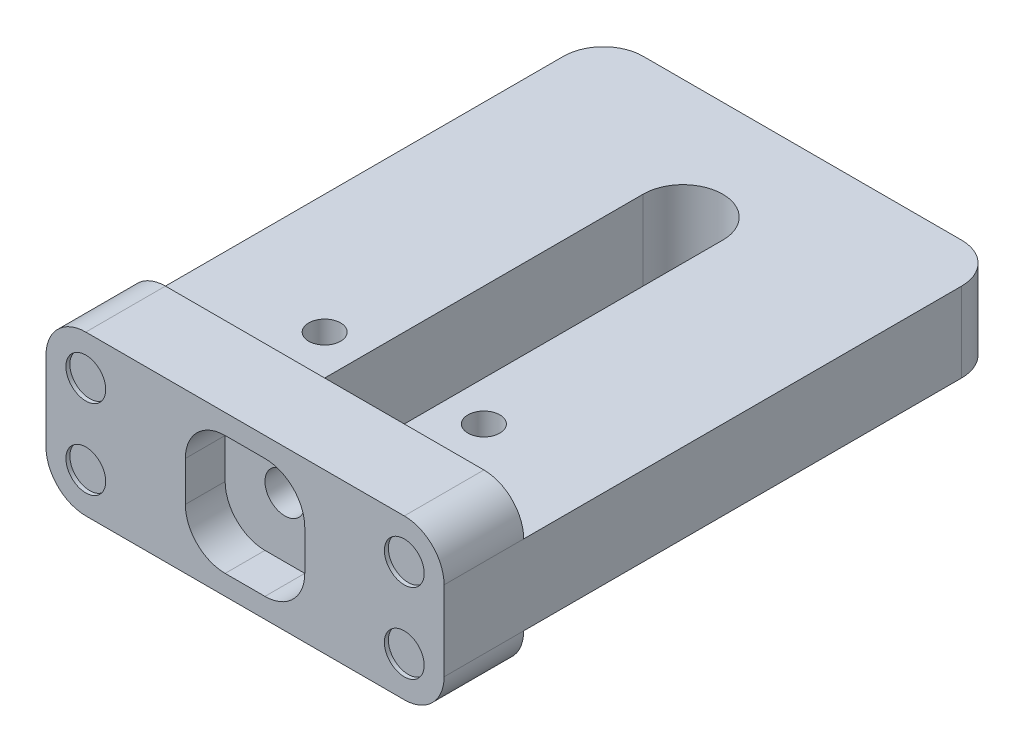
from build123d import *

# Parameters (mm, degrees)
SKETCH_1_W          = 100
SKETCH_1_H          = 120
SKETCH_1_R          = 4
EXTRUDE_1_DEPTH     = 20
SKETCH_4_W          = 100
SKETCH_4_H          = 40
EXTRUDE_2_DEPTH     = 20
SKETCH_5_W          = 30
SKETCH_5_H          = 30
CUT_EXTRUDE_1_DEPTH = 10
SKETCH_7_R          = 5
CUT_EXTRUDE_3_DEPTH = 110
SKETCH_8_R          = 5
CUT_EXTRUDE_4_DEPTH = 1
SKETCH_9_W          = 20
SKETCH_9_H          = 100
CUT_EXTRUDE_6_DEPTH = 99.994949366
FILLET_5_R          = 10
FILLET_2_R          = 10
FILLET_1_R          = 10
FILLET_9_R          = 10


with BuildPart() as part:
    # ｽｹｯﾁ1 → ﾎﾞｽ - 押し出し1 (new body)
    with BuildSketch(Plane(origin=(0, 0, 0), x_dir=(1, 0, 0), z_dir=(0, 1, 0))):
        Rectangle(SKETCH_1_W, SKETCH_1_H)
        with Locations(Location((-20, -40, 0), (0, 0, 270))):
            Circle(SKETCH_1_R, mode=Mode.SUBTRACT)
        with Locations(Location((20, -40, 0), (0, 0, 270))):
            Circle(SKETCH_1_R, mode=Mode.SUBTRACT)
    extrude(amount=EXTRUDE_1_DEPTH)

    # ｽｹｯﾁ4 → ﾎﾞｽ - 押し出し2 (add)
    with BuildSketch(Plane.XY.offset(60)):
        with Locations((0, 10)):
            Rectangle(SKETCH_4_W, SKETCH_4_H)
    extrude(amount=EXTRUDE_2_DEPTH)

    # ｽｹｯﾁ5 → ｶｯﾄ - 押し出し1 (cut)
    with BuildSketch(Plane.XY.offset(80)):
        with Locations((0, 10)):
            Rectangle(SKETCH_5_W, SKETCH_5_H)
    extrude(amount=-CUT_EXTRUDE_1_DEPTH, mode=Mode.SUBTRACT)

    # ｽｹｯﾁ7 → ｶｯﾄ - 押し出し3 (cut)
    with BuildSketch(Plane.XY.offset(70)):
        with Locations((0, 10)):
            Circle(SKETCH_7_R)
    extrude(amount=-CUT_EXTRUDE_3_DEPTH, mode=Mode.SUBTRACT)

    # ｽｹｯﾁ8 → ｶｯﾄ - 押し出し4 (cut)
    with BuildSketch(Plane.XY.offset(80)):
        with Locations((-40, 20)):
            Circle(SKETCH_8_R)
        with Locations(Location((40, 20, 0), (0, 0, 180))):
            Circle(SKETCH_8_R)
        with Locations((40, 0)):
            Circle(SKETCH_8_R)
        with Locations(Location((-40, 0, 0), (0, 0, 180))):
            Circle(SKETCH_8_R)
    extrude(amount=-CUT_EXTRUDE_4_DEPTH, mode=Mode.SUBTRACT)

    # ｽｹｯﾁ9 → ｶｯﾄ - 押し出し6 (cut, through all)
    with BuildSketch(Plane(origin=(0, 20, 0), x_dir=(1, 0, 0), z_dir=(0, 1, 0))):
        with Locations((0, -10)):
            Rectangle(SKETCH_9_W, SKETCH_9_H)
    extrude(amount=-CUT_EXTRUDE_6_DEPTH, mode=Mode.SUBTRACT)

    # ﾌｨﾚｯﾄ5
    fillet_5_edges = [part.edges().sort_by_distance(p)[0] for p in [
        (15, 25, 75),
        (15, -5, 75),
        (-15, -5, 75),
        (-15, 25, 75),
    ]]
    fillet(fillet_5_edges, radius=FILLET_5_R)

    # ﾌｨﾚｯﾄ2
    fillet_2_edges = [part.edges().sort_by_distance(p)[0] for p in [
        (-50, 10, -60),
        (50, 10, -60),
    ]]
    fillet(fillet_2_edges, radius=FILLET_2_R)

    # ﾌｨﾚｯﾄ1
    fillet_1_edges = [part.edges().sort_by_distance(p)[0] for p in [
        (50, 30, 70),
        (50, -10, 70),
        (-50, -10, 70),
        (-50, 30, 70),
    ]]
    fillet(fillet_1_edges, radius=FILLET_1_R)

    # ﾌｨﾚｯﾄ9
    fillet_9_edges = [part.edges().sort_by_distance(p)[0] for p in [
        (-10, 10, -40),
        (10, 10, -40),
    ]]
    fillet(fillet_9_edges, radius=FILLET_9_R - 0.0001)  # a hair under: the kernel refuses the full size


solid = part.part
